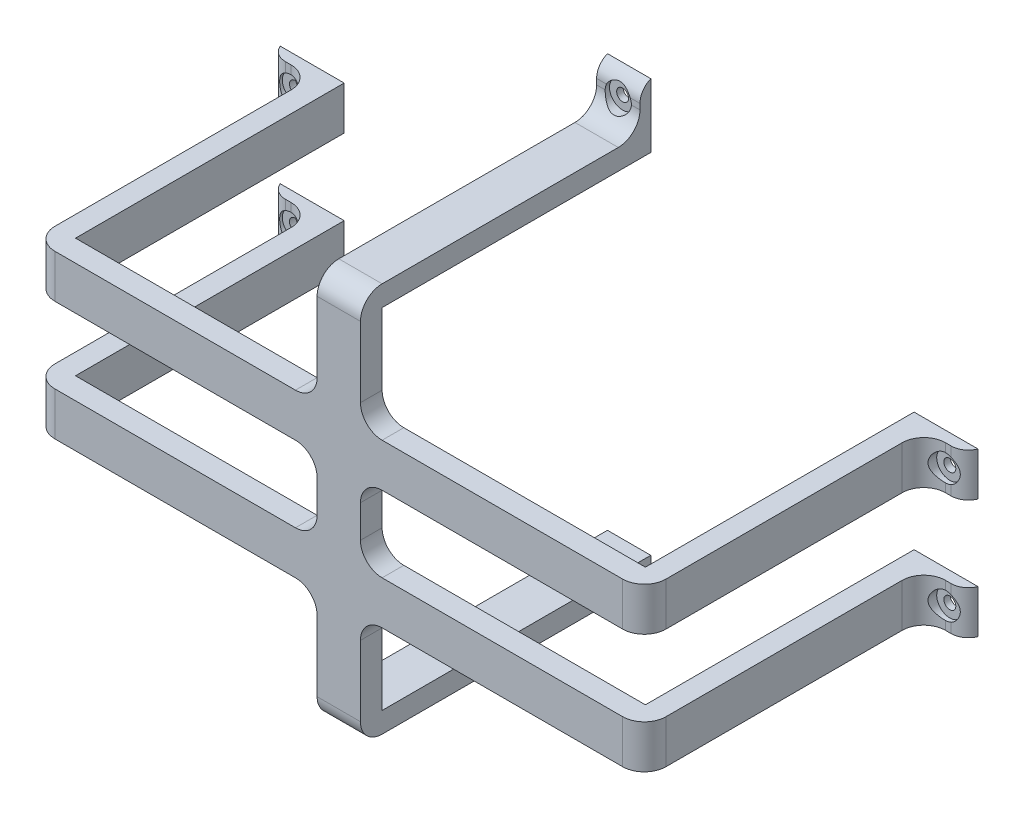
from build123d import *

# Parameters (mm, degrees)
BOSS_EXTRUDE1_DEPTH = 10
SKETCH4_W           = 20
SKETCH4_H           = 9.5
SKETCH4_W_2         = 9.5
SKETCH4_H_2         = 20
BOSS_EXTRUDE2_DEPTH = 123.98829641
SKETCH6_W           = 20
SKETCH6_H           = 20
BOSS_EXTRUDE3_DEPTH = 5
FILLET1_R           = 10
SKETCH7_R           = 6.05
CUT_EXTRUDE1_DEPTH  = 2
SKETCH8_R           = 2.75
CUT_EXTRUDE2_DEPTH  = 449.368901199
FILLET2_R           = 10
FILLET3_R           = 10
FILLET4_R           = 8


with BuildPart() as part:
    # Sketch1 → Boss-Extrude1 (new body)
    with BuildSketch(Plane.XY):
        Polygon((-256.029857926, 114.920096811), (-236.029857926, 114.920096811), (-236.029857926, 62.420096811), (-105.029857926, 62.420096811), (-105.029857926, 42.420096811), (-236.029857926, 42.420096811), (-236.029857926, 7.420096811), (-105.029857926, 7.420096811), (-105.029857926, -12.579903189), (-236.029857926, -12.579903189), (-236.029857926, -65.079903189), (-256.029857926, -65.079903189), (-256.029857926, -12.579903189), (-387.029857926, -12.579903189), (-387.029857926, 7.420096811), (-256.029857926, 7.420096811), (-256.029857926, 42.420096811), (-387.029857926, 42.420096811), (-387.029857926, 62.420096811), (-256.029857926, 62.420096811), align=None)
    extrude(amount=BOSS_EXTRUDE1_DEPTH)

    # Sketch4 → Boss-Extrude2 (add)
    with BuildSketch(Plane(origin=(0, 0, 0), x_dir=(-1, 0, 0), z_dir=(0, 0, -1))):
        with Locations((246.029857926, -60.329903189)):
            Rectangle(SKETCH4_W, SKETCH4_H)
        with Locations((109.779857926, -2.579903189)):
            Rectangle(SKETCH4_W_2, SKETCH4_H_2)
        with Locations((109.779857926, 52.420096811)):
            Rectangle(SKETCH4_W_2, SKETCH4_H_2)
        with Locations((246.029857926, 110.170096811)):
            Rectangle(SKETCH4_W, SKETCH4_H)
        with Locations((382.279857926, 52.420096811)):
            Rectangle(SKETCH4_W_2, SKETCH4_H_2)
        with Locations((382.279857926, -2.579903189)):
            Rectangle(SKETCH4_W_2, SKETCH4_H_2)
    extrude(amount=BOSS_EXTRUDE2_DEPTH)

    # Sketch6 → Boss-Extrude3 (add)
    with BuildSketch(Plane(origin=(0, 0, -123.98829641), x_dir=(-1, 0, 0), z_dir=(0, 0, -1))):
        with Locations((95.029857926, -2.579903189)):
            Rectangle(SKETCH6_W, SKETCH6_H)
        with Locations((95.029857926, 52.420096811)):
            Rectangle(SKETCH6_W, SKETCH6_H)
        with Locations((246.029857926, 124.920096811)):
            Rectangle(SKETCH6_W, SKETCH6_H)
        with Locations((397.029857926, 52.420096811)):
            Rectangle(SKETCH6_W, SKETCH6_H)
        with Locations((397.029857926, -2.579903189)):
            Rectangle(SKETCH6_W, SKETCH6_H)
        with Locations((246.029857926, -75.079903189)):
            Rectangle(SKETCH6_W, SKETCH6_H)
    extrude(amount=-BOSS_EXTRUDE3_DEPTH)

    # Fillet1
    fillet1_edges = [part.edges().sort_by_distance(p)[0] for p in [
        (-105.029857926, -2.579903189, -118.98829641),
        (-105.029857926, 52.420096811, -118.98829641),
        (-246.029857926, 114.920096811, -118.98829641),
        (-387.029857926, 52.420096811, -118.98829641),
        (-387.029857926, -2.579903189, -118.98829641),
        (-246.029857926, -65.079903189, -118.98829641),
    ]]
    fillet(fillet1_edges, radius=FILLET1_R)

    # Sketch7 → Cut-Extrude1 (cut, symmetric)
    with BuildSketch(Plane.XY.offset(-118.98829641)):
        with Locations((-246.029857926, 124.920096811)):
            Circle(SKETCH7_R)
        with Locations((-95.029857926, 52.420096811)):
            Circle(SKETCH7_R)
        with Locations((-95.029857926, -2.579903189)):
            Circle(SKETCH7_R)
        with Locations((-246.029857926, -75.079903189)):
            Circle(SKETCH7_R)
        with Locations((-397.029857926, -2.579903189)):
            Circle(SKETCH7_R)
        with Locations((-397.029857926, 52.420096811)):
            Circle(SKETCH7_R)
    extrude(amount=CUT_EXTRUDE1_DEPTH, both=True, mode=Mode.SUBTRACT)

    # Sketch8 → Cut-Extrude2 (cut, through all)
    with BuildSketch(Plane.XY.offset(-120.98829641)):
        with Locations((-246.029857926, -75.079903189)):
            Circle(SKETCH8_R)
        with Locations((-397.029857926, -2.579903189)):
            Circle(SKETCH8_R)
        with Locations((-397.029857926, 52.420096811)):
            Circle(SKETCH8_R)
        with Locations((-246.029857926, 124.920096811)):
            Circle(SKETCH8_R)
        with Locations((-95.029857926, 52.420096811)):
            Circle(SKETCH8_R)
        with Locations((-95.029857926, -2.579903189)):
            Circle(SKETCH8_R)
    extrude(amount=-CUT_EXTRUDE2_DEPTH, mode=Mode.SUBTRACT)

    # Fillet2
    fillet2_edges = [part.edges().sort_by_distance(p)[0] for p in [
        (-387.029857926, 52.420096811, 10),
        (-387.029857926, -2.579903189, 10),
        (-246.029857926, -65.079903189, 10),
        (-105.029857926, -2.579903189, 10),
        (-105.029857926, 52.420096811, 10),
        (-246.029857926, 114.920096811, 10),
    ]]
    fillet(fillet2_edges, radius=FILLET2_R)

    # Fillet3
    fillet3_edges = [part.edges().sort_by_distance(p)[0] for p in [
        (-236.029857926, 62.420096811, 5),
        (-236.029857926, 42.420096811, 5),
        (-236.029857926, 7.420096811, 5),
        (-236.029857926, -12.579903189, 5),
        (-256.029857926, -12.579903189, 5),
        (-256.029857926, 7.420096811, 5),
        (-256.029857926, 42.420096811, 5),
        (-256.029857926, 62.420096811, 5),
    ]]
    fillet(fillet3_edges, radius=FILLET3_R)

    # Fillet4
    # the kernel refuses this fillet: 8 mm, written as the material it takes off along each edge
    with BuildSketch(Plane(origin=(-217.489361708, 134.920096811, -118.98829641), x_dir=(0, -1, 0), z_dir=(-1, 0, 0)), Plane(origin=(-407.029857926, 80.960593029, -118.98829641), x_dir=(1, 0, 0), z_dir=(0, -1, 0)), Plane(origin=(-407.029857926, 25.960593029, -118.98829641), x_dir=(1, 0, 0), z_dir=(0, -1, 0)), Plane(origin=(-85.029857926, -31.120399407, -118.98829641), x_dir=(-1, 0, 0), z_dir=(0, 1, 0)), Plane(origin=(-85.029857926, 23.879600593, -118.98829641), x_dir=(-1, 0, 0), z_dir=(0, 1, 0))) as fillet4_piece_1:
        with BuildLine():
            CenterArc((7.416198487, -8), FILLET4_R, 90, 67.975687163)
            Line((0, -5), (0, 0))
            Line((0, 0), (7.416198487, 0))
        make_face()
    extrude(amount=57.080992435, mode=Mode.SUBTRACT)
    with BuildSketch(Plane(origin=(-217.489361708, -85.079903189, -118.98829641), x_dir=(0, 1, 0), z_dir=(-1, 0, 0))) as fillet4_piece_2:
        with BuildLine():
            CenterArc((7.416198487, 8), FILLET4_R, 202.024312837, 67.975687163)
            Line((0, 5), (0, 0))
            Line((0, 0), (7.416198487, 0))
        make_face()
    extrude(amount=57.080992435, mode=Mode.SUBTRACT)


solid = part.part
